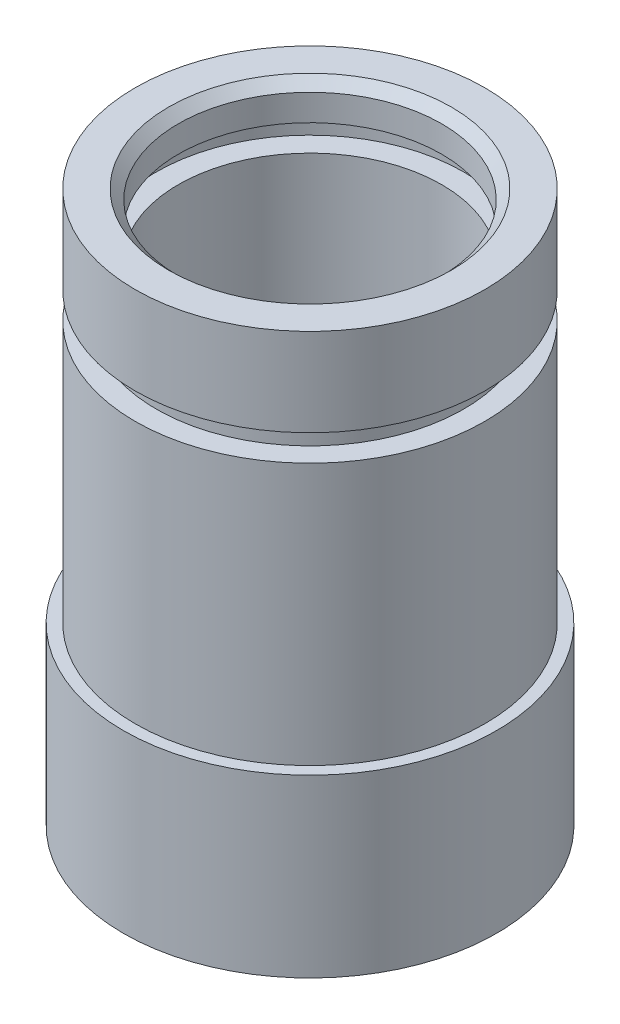
from build123d import *


with BuildPart() as part:
    # Sketch1 → Revolve1 (revolve)
    with BuildSketch(Plane.XY):
        Polygon((19.05, -3.511327887), (19.05, -37.547327887), (15.875, -37.547327887), (25.7175, -74.28003796), (26.9875, -74.28003796), (26.9875, -48.88003796), (25.2857, -48.88003796), (25.2857, -11.004327887), (22.225, -11.004327887), (22.225, -7.194327887), (25.2857, -7.194327887), (25.2857, 5.505672113), (20.447, 5.505672113), (19.05, 4.108672113), (19.05, 0.298672113), (22.225, 0.298672113), (22.225, -3.511327887), align=None)
    revolve(axis=Axis((0, 0, 0), (0, 1, 0)))


solid = part.part
